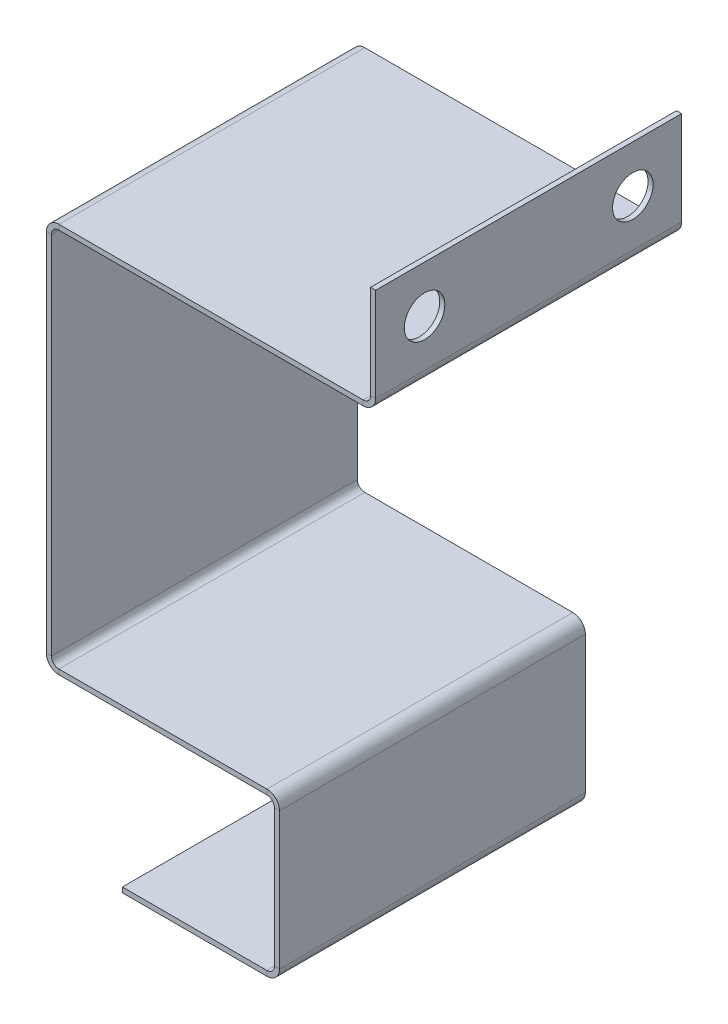
from build123d import *

# Parameters (mm, degrees)
SKETCH1_W                    = 15
SKETCH1_H                    = 30.181487224
BASE_FLANGE2_DEPTH           = 0.5
EDGE_FLANGE1_STRIP_W         = 3.4732
EDGE_FLANGE1_STRIP_H         = 0.5
EDGE_FLANGE1_STRIP_CUT_DEPTH = 30.181487223
EDGE_FLANGE1_DEPTH           = 30.181487223
EDGE_FLANGE2_STRIP_W         = 3.4732
EDGE_FLANGE2_STRIP_H         = 0.5
EDGE_FLANGE2_STRIP_CUT_DEPTH = 30.181487223
EDGE_FLANGE2_DEPTH           = 30.181487223
EDGE_FLANGE6_STRIP_W         = 3.4732
EDGE_FLANGE6_STRIP_H         = 0.5
EDGE_FLANGE6_STRIP_CUT_DEPTH = 30.181487223
EDGE_FLANGE6_DEPTH           = 30.181487223
EDGE_FLANGE7_STRIP_W         = 3.4732
EDGE_FLANGE7_STRIP_H         = 0.5
EDGE_FLANGE7_STRIP_CUT_DEPTH = 30.181487223
EDGE_FLANGE7_DEPTH           = 30.181487223
EDGE_FLANGE8_STRIP_W         = 3.4732
EDGE_FLANGE8_STRIP_H         = 0.5
EDGE_FLANGE8_STRIP_CUT_DEPTH = 30.181487223
EDGE_FLANGE8_DEPTH           = 30.181487223
SKETCH58_R                   = 2
CUT_EXTRUDE1_DEPTH           = 74.128178856


# Sheet-metal steps are written as plain solids
with BuildPart() as part:
    # Sketch1 → Base-Flange2 (new body)
    with BuildSketch(Plane(origin=(0, 0, 0), x_dir=(1, 0, 0), z_dir=(0, 1, 0))):
        Rectangle(SKETCH1_W, SKETCH1_H)
    extrude(amount=BASE_FLANGE2_DEPTH)

    # Edge-Flange1 strip (across the edge) → Edge-Flange1 strip cut (cut)
    with BuildSketch(Plane(origin=(7.5, 0.5, 15.090743612), x_dir=(-1, 0, 0), z_dir=(0, 0, -1))):
        with Locations((-1, -0.25)):
            Rectangle(EDGE_FLANGE1_STRIP_W, EDGE_FLANGE1_STRIP_H)
    extrude(amount=EDGE_FLANGE1_STRIP_CUT_DEPTH, mode=Mode.SUBTRACT)

    # Edge-Flange1 section (across the edge) → Edge-Flange1 (add)
    with BuildSketch(Plane(origin=(7.5, 0.5, 15.090743612), x_dir=(-1, 0, 0), z_dir=(0, 0, -1))):
        with BuildLine():
            Line((-0.5, 0.7366), (-0.5, 15))
            Line((-0.5, 15), (0, 15))
            Line((0, 15), (0, 0.7366))
            ThreePointArc((0, 0.7366), (0.215745145, 0.215745145), (0.7366, 0))
            Line((0.7366, 0), (0.7366, -0.5))
            ThreePointArc((0.7366, -0.5), (-0.137808246, -0.137808246), (-0.5, 0.7366))
        make_face()
    extrude(amount=EDGE_FLANGE1_DEPTH)

    # Edge-Flange2 strip (across the edge) → Edge-Flange2 strip cut (cut)
    with BuildSketch(Plane(origin=(7.5, 15.5, 15.090743612), x_dir=(0, -1, 0), z_dir=(0, 0, -1))):
        with Locations((-1, -0.25)):
            Rectangle(EDGE_FLANGE2_STRIP_W, EDGE_FLANGE2_STRIP_H)
    extrude(amount=EDGE_FLANGE2_STRIP_CUT_DEPTH, mode=Mode.SUBTRACT)

    # Edge-Flange2 section (across the edge) → Edge-Flange2 (add)
    with BuildSketch(Plane(origin=(7.5, 15.5, 15.090743612), x_dir=(0, -1, 0), z_dir=(0, 0, -1))):
        with BuildLine():
            Line((-0.5, 0.7366), (-0.5, 22))
            Line((-0.5, 22), (0, 22))
            Line((0, 22), (0, 0.7366))
            ThreePointArc((0, 0.7366), (0.215745145, 0.215745145), (0.7366, 0))
            Line((0.7366, 0), (0.7366, -0.5))
            ThreePointArc((0.7366, -0.5), (-0.137808246, -0.137808246), (-0.5, 0.7366))
        make_face()
    extrude(amount=EDGE_FLANGE2_DEPTH)

    # Edge-Flange6 strip (across the edge) → Edge-Flange6 strip cut (cut)
    with BuildSketch(Plane(origin=(-14.5, 16, -15.090743612), x_dir=(1, 0, 0), z_dir=(0, 0, 1))):
        with Locations((-1, -0.25)):
            Rectangle(EDGE_FLANGE6_STRIP_W, EDGE_FLANGE6_STRIP_H)
    extrude(amount=EDGE_FLANGE6_STRIP_CUT_DEPTH, mode=Mode.SUBTRACT)

    # Edge-Flange6 section (across the edge) → Edge-Flange6 (add)
    with BuildSketch(Plane(origin=(-14.5, 16, -15.090743612), x_dir=(1, 0, 0), z_dir=(0, 0, 1))):
        with BuildLine():
            Line((-0.5, 0.7366), (-0.5, 37.5))
            Line((-0.5, 37.5), (0, 37.5))
            Line((0, 37.5), (0, 0.7366))
            ThreePointArc((0, 0.7366), (0.215745145, 0.215745145), (0.7366, 0))
            Line((0.7366, 0), (0.7366, -0.5))
            ThreePointArc((0.7366, -0.5), (-0.137808246, -0.137808246), (-0.5, 0.7366))
        make_face()
    extrude(amount=EDGE_FLANGE6_DEPTH)

    # Edge-Flange7 strip (across the edge) → Edge-Flange7 strip cut (cut)
    with BuildSketch(Plane(origin=(-14.5, 53.5, -15.090743612), x_dir=(0, -1, 0), z_dir=(0, 0, 1))):
        with Locations((-1, -0.25)):
            Rectangle(EDGE_FLANGE7_STRIP_W, EDGE_FLANGE7_STRIP_H)
    extrude(amount=EDGE_FLANGE7_STRIP_CUT_DEPTH, mode=Mode.SUBTRACT)

    # Edge-Flange7 section (across the edge) → Edge-Flange7 (add)
    with BuildSketch(Plane(origin=(-14.5, 53.5, -15.090743612), x_dir=(0, -1, 0), z_dir=(0, 0, 1))):
        with BuildLine():
            Line((-0.5, 0.7366), (-0.5, 31.5))
            Line((-0.5, 31.5), (0, 31.5))
            Line((0, 31.5), (0, 0.7366))
            ThreePointArc((0, 0.7366), (0.215745145, 0.215745145), (0.7366, 0))
            Line((0.7366, 0), (0.7366, -0.5))
            ThreePointArc((0.7366, -0.5), (-0.137808246, -0.137808246), (-0.5, 0.7366))
        make_face()
    extrude(amount=EDGE_FLANGE7_DEPTH)

    # Edge-Flange8 strip (across the edge) → Edge-Flange8 strip cut (cut)
    with BuildSketch(Plane(origin=(17, 54, 15.090743612), x_dir=(-1, 0, 0), z_dir=(0, 0, -1))):
        with Locations((-1, -0.25)):
            Rectangle(EDGE_FLANGE8_STRIP_W, EDGE_FLANGE8_STRIP_H)
    extrude(amount=EDGE_FLANGE8_STRIP_CUT_DEPTH, mode=Mode.SUBTRACT)

    # Edge-Flange8 section (across the edge) → Edge-Flange8 (add)
    with BuildSketch(Plane(origin=(17, 54, 15.090743612), x_dir=(-1, 0, 0), z_dir=(0, 0, -1))):
        with BuildLine():
            Line((-0.5, 0.7366), (-0.5, 10))
            Line((-0.5, 10), (0, 10))
            Line((0, 10), (0, 0.7366))
            ThreePointArc((0, 0.7366), (0.215745145, 0.215745145), (0.7366, 0))
            Line((0.7366, 0), (0.7366, -0.5))
            ThreePointArc((0.7366, -0.5), (-0.137808246, -0.137808246), (-0.5, 0.7366))
        make_face()
    extrude(amount=EDGE_FLANGE8_DEPTH)

    # Sketch58 → Cut-Extrude1 (cut, through all)
    with BuildSketch(Plane.ZY.offset(-17)):
        with Locations(Location((10.276185244, 59.3683, 0), (0, 0, 270))):
            Circle(SKETCH58_R)
        with Locations(Location((-10.276185244, 59.3683, 0), (0, 0, 90))):
            Circle(SKETCH58_R)
    extrude(amount=-CUT_EXTRUDE1_DEPTH, mode=Mode.SUBTRACT)


solid = part.part
